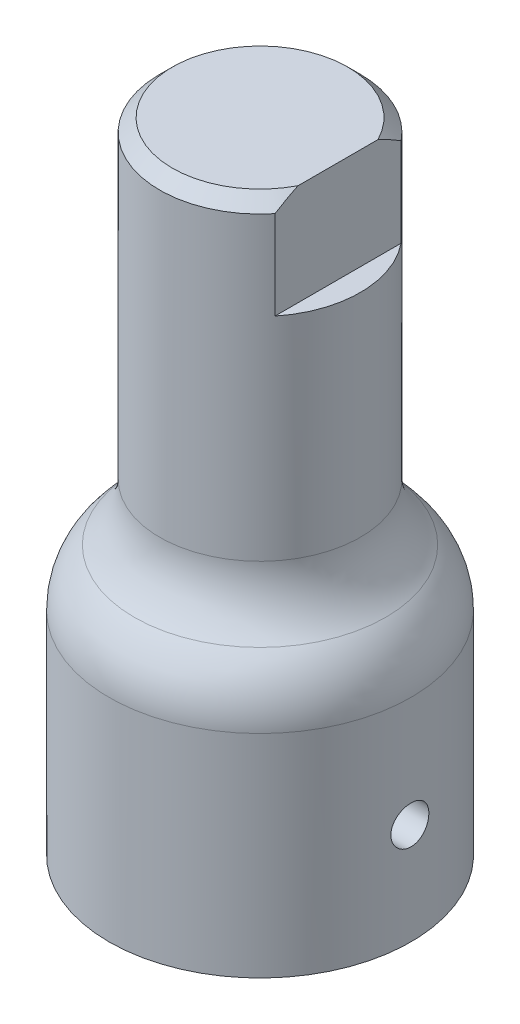
from build123d import *

# Parameters (mm, degrees)
SKETCH1_R           = 6.2865
BASE_EXTRUDE_DEPTH  = 40
SKETCH3_R           = 9.4615
BOSS_EXTRUDE1_DEPTH = 15.875
CUT_EXTRUDE1_DEPTH  = 12.7
FILLET1_R           = 4.7625
FILLET2_R           = 4.7625
SKETCH5_R           = 1.190625
CUT_EXTRUDE2_DEPTH  = 44.537009406
CUT_EXTRUDE3_START  = -6.35
CUT_EXTRUDE3_DEPTH  = 6.35
CHAMFER1_SIZE       = 0.79375


with BuildPart() as part:
    # Sketch1 → Base-Extrude (new body)
    with BuildSketch(Plane(origin=(0, 0, 0), x_dir=(-1, 0, 0), z_dir=(0, 1, 0))):
        with Locations(Location((0, 0, 0), (0, 0, 90))):
            Circle(SKETCH1_R)
    extrude(amount=BASE_EXTRUDE_DEPTH)

    # Sketch3 → Boss-Extrude1 (add)
    with BuildSketch(Plane(origin=(0, 0, 0), x_dir=(-1, 0, 0), z_dir=(0, 1, 0))):
        with Locations(Location((0, 0, 0), (0, 0, 90))):
            Circle(SKETCH3_R)
    extrude(amount=BOSS_EXTRUDE1_DEPTH)

    # Sketch4 → Cut-Extrude1 (cut)
    with BuildSketch(Plane(origin=(0, 0, 0), x_dir=(-1, 0, 0), z_dir=(0, 1, 0))):
        with BuildLine():
            Line((-4.8895, 4.247860491), (-4.8895, -4.247860491))
            ThreePointArc((-4.8895, -4.247860491), (6.477, 0), (-4.8895, 4.247860491))
        make_face()
    extrude(amount=CUT_EXTRUDE1_DEPTH, mode=Mode.SUBTRACT)

    # Fillet1
    # the kernel refuses this fillet: 4.7625 mm, written as the material it adds along each edge
    with BuildSketch(Plane(origin=(0, 15.875, 0), x_dir=(0, 0, 1), z_dir=(1, 0, 0))) as fillet1_piece_1:
        with BuildLine():
            CenterArc((11.049, -4.490128061), FILLET1_R, 109.471220634, 70.528779366)
            Line((6.2865, -4.490128061), (6.19125, -4.490128061))
            Line((6.19125, -4.490128061), (6.19125, 0))
            Line((6.19125, 0), (6.2865, 0.09525))
            ThreePointArc((6.2865, 0.09525), (7.874, 0.09525), (9.42975, 0.089802561))
            Line((9.42975, 0.089802561), (9.4615, 0))
        make_face()
    revolve(axis=Axis((0, 15.875, 0), (0, -1, 0)))

    # Fillet2
    fillet2_edges = [part.edges().sort_by_distance(p)[0] for p in [
        (0, 15.875, -9.4615),
    ]]
    fillet(fillet2_edges, radius=FILLET2_R)

    # Sketch5 → Cut-Extrude2 (cut, through all)
    with BuildSketch(Plane.ZY.offset(-4.8895)):
        with Locations((0, 6.35)):
            Circle(SKETCH5_R)
    extrude(amount=-CUT_EXTRUDE2_DEPTH, mode=Mode.SUBTRACT)

    # Sketch7 → Cut-Extrude3 (cut)
    with BuildSketch(Plane(origin=(0, 40, 0), x_dir=(-1, 0, 0), z_dir=(0, 1, 0)).offset(CUT_EXTRUDE3_START)):
        with BuildLine():
            Line((-4.8895, 3.951312693), (-4.8895, -3.951312693))
            ThreePointArc((-4.8895, -3.951312693), (-6.2865, 0), (-4.8895, 3.951312693))
        make_face()
    extrude(amount=CUT_EXTRUDE3_DEPTH, mode=Mode.SUBTRACT)

    # Chamfer1
    chamfer1_edges = [part.edges().sort_by_distance(p)[0] for p in [
        (-5.67274226, 40, -2.70925774),
    ]]
    chamfer(chamfer1_edges, length=CHAMFER1_SIZE)


solid = part.part
